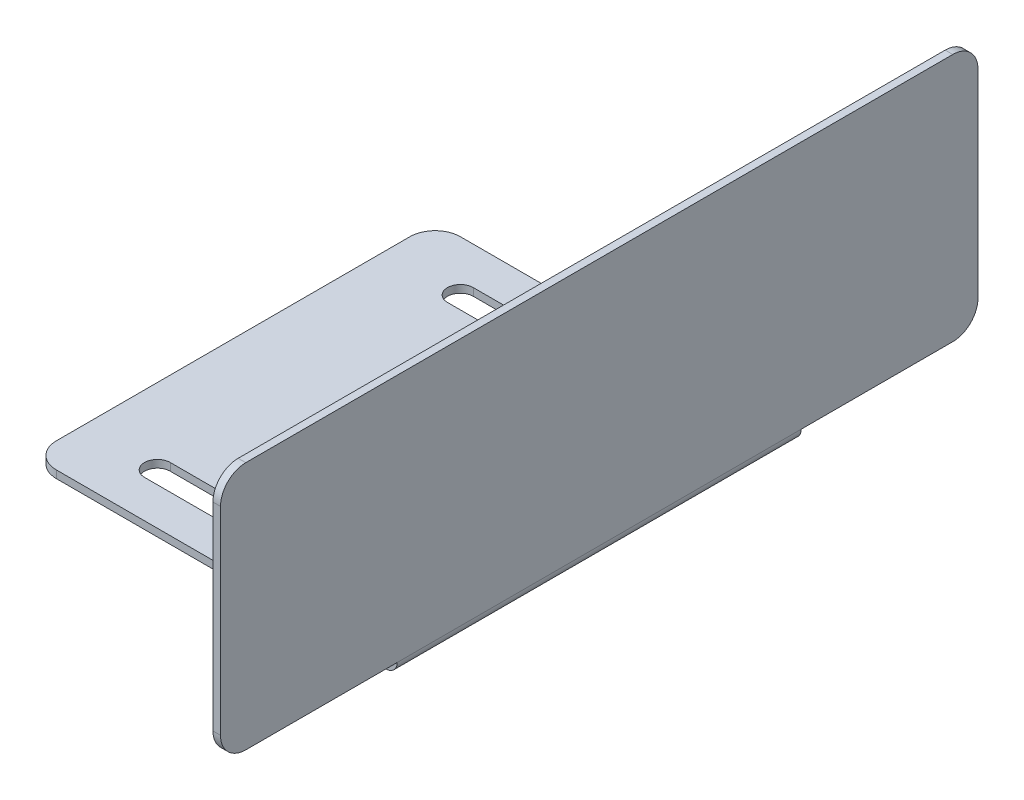
from build123d import *

# Parameters (mm, degrees)
BASE_FLANGE1_DEPTH = 150
CUT_EXTRUDE2_DEPTH = 163.385344166
SKETCH5_W          = 35
SKETCH5_H          = 2.2366
CUT_EXTRUDE3_DEPTH = 169.696472992
FILLET1_R          = 5


# Sheet-metal steps are written as plain solids
with BuildPart() as part:
    # Sketch1 → Base-Flange1 (new body)
    with BuildSketch(Plane.XY):
        with BuildLine():
            Line((-35.5, -25), (34.7634, -25))
            ThreePointArc((34.7634, -25), (35.284254855, -24.784254855), (35.5, -24.2634))
            Line((35.5, -24.2634), (35.5, 25))
            Line((35.5, 25), (37, 25))
            Line((37, 25), (37, -24.2634))
            ThreePointArc((37, -24.2634), (36.344915027, -25.844915027), (34.7634, -26.5))
            Line((34.7634, -26.5), (-35.5, -26.5))
            Line((-35.5, -26.5), (-35.5, -25))
        make_face()
    extrude(amount=BASE_FLANGE1_DEPTH)

    # Sketch4 → Cut-Extrude2 (cut, through all)
    with BuildSketch(Plane(origin=(0, -25, 0), x_dir=(1, 0, 0), z_dir=(0, 1, 0))):
        with BuildLine():
            Line((-20.5, -102.45), (-5.5, -102.45))
            ThreePointArc((-5.5, -102.45), (-2.95, -105), (-5.5, -107.55))
            Line((-5.5, -107.55), (-20.5, -107.55))
            ThreePointArc((-20.5, -107.55), (-23.05, -105), (-20.5, -102.45))
        make_face()
        with BuildLine():
            Line((-20.5, -42.45), (-5.5, -42.45))
            ThreePointArc((-5.5, -42.45), (-2.95, -45), (-5.5, -47.55))
            Line((-5.5, -47.55), (-20.5, -47.55))
            ThreePointArc((-20.5, -47.55), (-23.05, -45), (-20.5, -42.45))
        make_face()
    extrude(amount=-CUT_EXTRUDE2_DEPTH, mode=Mode.SUBTRACT)

    # Sketch5 → Cut-Extrude3 (cut, through all)
    with BuildSketch(Plane.ZY.offset(35.5)):
        with Locations((132.5, -25.3817)):
            Rectangle(SKETCH5_W, SKETCH5_H)
        with Locations((17.5, -25.3817)):
            Rectangle(SKETCH5_W, SKETCH5_H)
    extrude(amount=-CUT_EXTRUDE3_DEPTH, mode=Mode.SUBTRACT)

    # Fillet1
    fillet1_edges = [part.edges().sort_by_distance(p)[0] for p in [
        (36.25, -24.2634, 0),
        (36.25, -24.2634, 150),
        (36.25, 25, 150),
        (-35.5, -25.75, 115),
        (36.25, 25, 0),
        (-35.5, -25.75, 35),
    ]]
    fillet(fillet1_edges, radius=FILLET1_R)


solid = part.part
